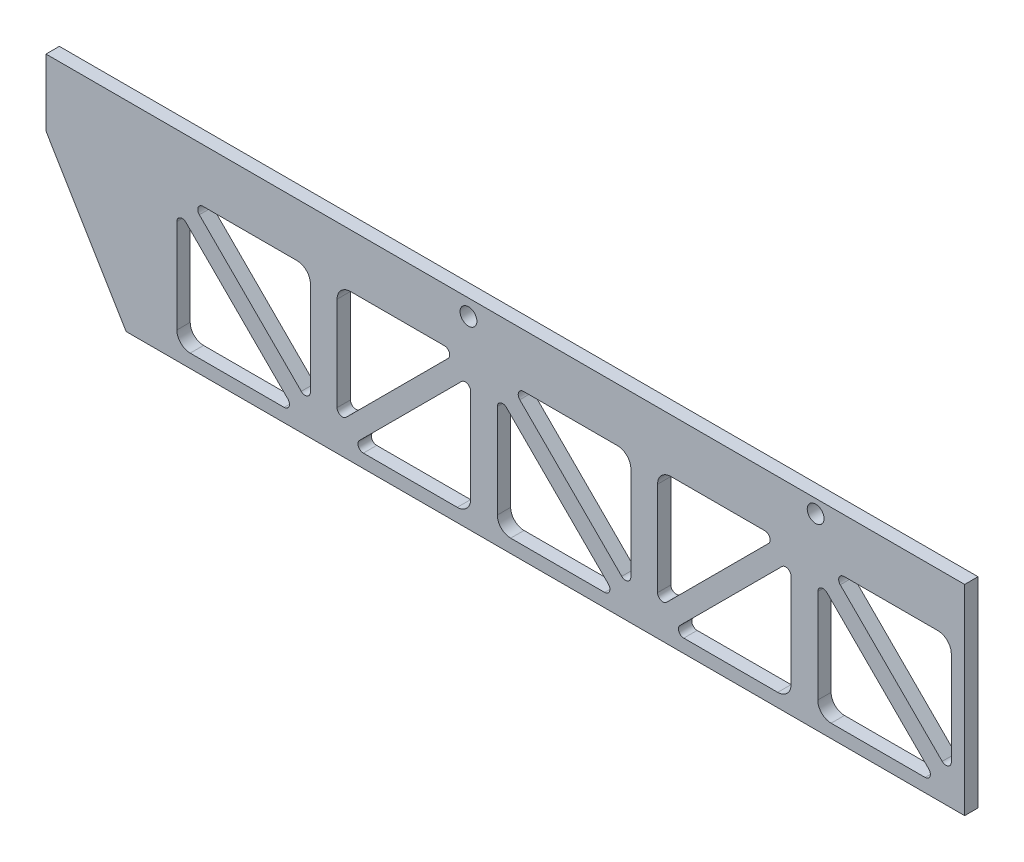
from build123d import *

# Parameters (mm, degrees)
MODEL_R             = 4
BOSS_EXTRUDE1_DEPTH = 6.35


with BuildPart() as part:
    # Model → Boss-Extrude1 (new body)
    with BuildSketch(Plane.XY):
        Polygon((-398.78, 0), (-436.88, 63.5), (-436.88, 95.25), (0, 95.25), (0, 0), align=None)
        with Locations((-70.866, 88.9)):
            Circle(MODEL_R, mode=Mode.SUBTRACT)
        with Locations((-235.966, 87.63)):
            Circle(MODEL_R, mode=Mode.SUBTRACT)
        with BuildLine():
            Line((-171.232102448, 6.35), (-215.9, 6.35))
            ThreePointArc((-215.9, 6.35), (-220.390128061, 8.209871939), (-222.25, 12.7))
            Line((-222.25, 12.7), (-222.25, 57.367897552))
            ThreePointArc((-222.25, 57.367897552), (-220.682015918, 59.714551564), (-217.913948776, 59.163948776))
            Line((-217.913948776, 59.163948776), (-169.436051224, 10.686051224))
            ThreePointArc((-169.436051224, 10.686051224), (-168.885448436, 7.917984082), (-171.232102448, 6.35))
        make_face(mode=Mode.SUBTRACT)
        with BuildLine():
            Line((-234.95, 57.367897552), (-234.95, 12.7))
            ThreePointArc((-234.95, 12.7), (-236.809871939, 8.209871939), (-241.3, 6.35))
            Line((-241.3, 6.35), (-285.967897552, 6.35))
            ThreePointArc((-285.967897552, 6.35), (-288.314551564, 7.917984082), (-287.763948776, 10.686051224))
            Line((-287.763948776, 10.686051224), (-239.286051224, 59.163948776))
            ThreePointArc((-239.286051224, 59.163948776), (-236.517984082, 59.714551564), (-234.95, 57.367897552))
        make_face(mode=Mode.SUBTRACT)
        with BuildLine():
            Line((-294.113948776, 17.036051224), (-245.636051224, 65.513948776))
            ThreePointArc((-245.636051224, 65.513948776), (-245.085448436, 68.282015918), (-247.432102448, 69.85))
            Line((-247.432102448, 69.85), (-292.1, 69.85))
            ThreePointArc((-292.1, 69.85), (-296.590128061, 67.990128061), (-298.45, 63.5))
            Line((-298.45, 63.5), (-298.45, 18.832102448))
            ThreePointArc((-298.45, 18.832102448), (-296.882015918, 16.485448436), (-294.113948776, 17.036051224))
        make_face(mode=Mode.SUBTRACT)
        with BuildLine():
            Line((-323.632102448, 6.35), (-368.3, 6.35))
            ThreePointArc((-368.3, 6.35), (-372.790128061, 8.209871939), (-374.65, 12.7))
            Line((-374.65, 12.7), (-374.65, 57.367897552))
            ThreePointArc((-374.65, 57.367897552), (-373.082015918, 59.714551564), (-370.313948776, 59.163948776))
            Line((-370.313948776, 59.163948776), (-321.836051224, 10.686051224))
            ThreePointArc((-321.836051224, 10.686051224), (-321.285448436, 7.917984082), (-323.632102448, 6.35))
        make_face(mode=Mode.SUBTRACT)
        with BuildLine():
            Line((-18.832102448, 6.35), (-63.5, 6.35))
            ThreePointArc((-63.5, 6.35), (-67.990128061, 8.209871939), (-69.85, 12.7))
            Line((-69.85, 12.7), (-69.85, 57.367897552))
            ThreePointArc((-69.85, 57.367897552), (-68.282015918, 59.714551564), (-65.513948776, 59.163948776))
            Line((-65.513948776, 59.163948776), (-17.036051224, 10.686051224))
            ThreePointArc((-17.036051224, 10.686051224), (-16.485448436, 7.917984082), (-18.832102448, 6.35))
        make_face(mode=Mode.SUBTRACT)
        with BuildLine():
            Line((-82.55, 57.367897552), (-82.55, 12.7))
            ThreePointArc((-82.55, 12.7), (-84.409871939, 8.209871939), (-88.9, 6.35))
            Line((-88.9, 6.35), (-133.567897552, 6.35))
            ThreePointArc((-133.567897552, 6.35), (-135.914551564, 7.917984082), (-135.363948776, 10.686051224))
            Line((-135.363948776, 10.686051224), (-86.886051224, 59.163948776))
            ThreePointArc((-86.886051224, 59.163948776), (-84.117984082, 59.714551564), (-82.55, 57.367897552))
        make_face(mode=Mode.SUBTRACT)
        with BuildLine():
            Line((-93.236051224, 65.513948776), (-141.713948776, 17.036051224))
            ThreePointArc((-141.713948776, 17.036051224), (-144.482015918, 16.485448436), (-146.05, 18.832102448))
            Line((-146.05, 18.832102448), (-146.05, 63.5))
            ThreePointArc((-146.05, 63.5), (-144.190128061, 67.990128061), (-139.7, 69.85))
            Line((-139.7, 69.85), (-95.032102448, 69.85))
            ThreePointArc((-95.032102448, 69.85), (-92.685448436, 68.282015918), (-93.236051224, 65.513948776))
        make_face(mode=Mode.SUBTRACT)
        with BuildLine():
            Line((-163.086051224, 17.036051224), (-211.563948776, 65.513948776))
            ThreePointArc((-211.563948776, 65.513948776), (-212.114551564, 68.282015918), (-209.767897552, 69.85))
            Line((-209.767897552, 69.85), (-165.1, 69.85))
            ThreePointArc((-165.1, 69.85), (-160.609871939, 67.990128061), (-158.75, 63.5))
            Line((-158.75, 63.5), (-158.75, 18.832102448))
            ThreePointArc((-158.75, 18.832102448), (-160.317984082, 16.485448436), (-163.086051224, 17.036051224))
        make_face(mode=Mode.SUBTRACT)
        with BuildLine():
            Line((-315.486051224, 17.036051224), (-363.963948776, 65.513948776))
            ThreePointArc((-363.963948776, 65.513948776), (-364.514551564, 68.282015918), (-362.167897552, 69.85))
            Line((-362.167897552, 69.85), (-317.5, 69.85))
            ThreePointArc((-317.5, 69.85), (-313.009871939, 67.990128061), (-311.15, 63.5))
            Line((-311.15, 63.5), (-311.15, 18.832102448))
            ThreePointArc((-311.15, 18.832102448), (-312.717984082, 16.485448436), (-315.486051224, 17.036051224))
        make_face(mode=Mode.SUBTRACT)
        with BuildLine():
            Line((-6.35, 63.5), (-6.35, 18.832102448))
            ThreePointArc((-6.35, 18.832102448), (-7.917984082, 16.485448436), (-10.686051224, 17.036051224))
            Line((-10.686051224, 17.036051224), (-59.163948776, 65.513948776))
            ThreePointArc((-59.163948776, 65.513948776), (-59.714551564, 68.282015918), (-57.367897552, 69.85))
            Line((-57.367897552, 69.85), (-12.7, 69.85))
            ThreePointArc((-12.7, 69.85), (-8.209871939, 67.990128061), (-6.35, 63.5))
        make_face(mode=Mode.SUBTRACT)
    extrude(amount=BOSS_EXTRUDE1_DEPTH)


solid = part.part
